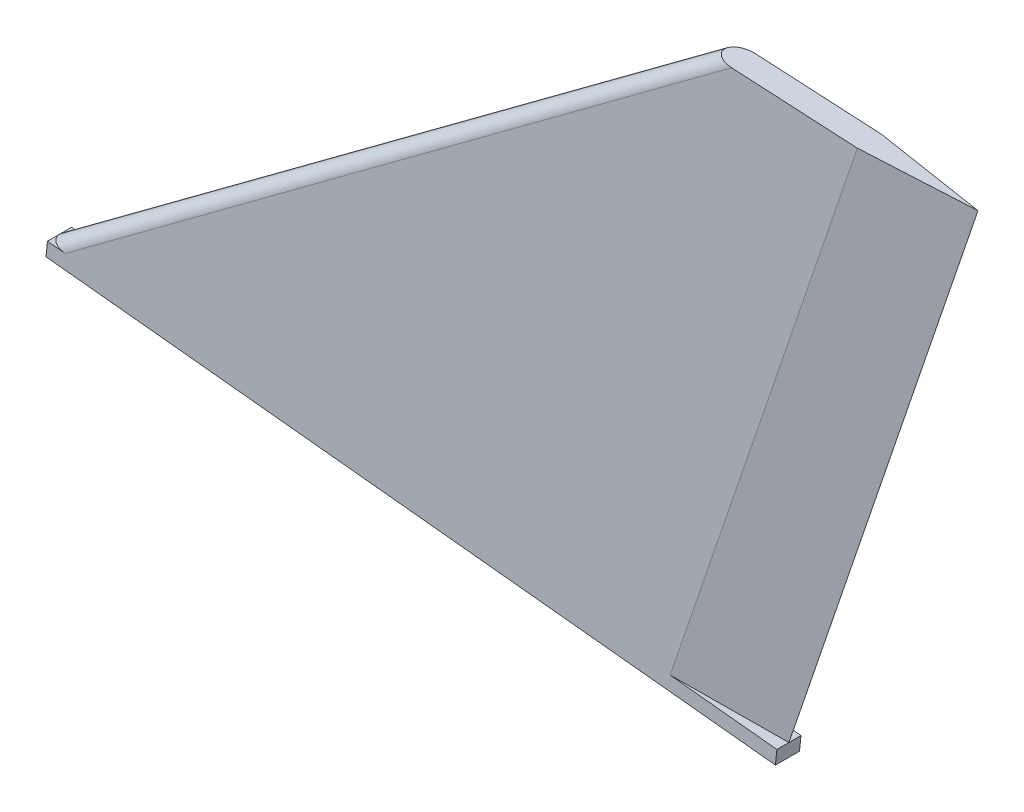
from build123d import *

# Parameters (mm, degrees)
BOSS_EXTRUDE1_DEPTH = 8.4
CUT_EXTRUDE2_DEPTH  = 362.634640928
CUT_EXTRUDE4_DEPTH  = 362.634640928
FILLET1_R           = 4.2
SKETCH14_W          = 255.7
SKETCH14_H          = 8.4
BOSS_EXTRUDE2_DEPTH = 5


with BuildPart() as part:
    # Sketch1 → Boss-Extrude1 (new body)
    with BuildSketch(Plane.XY):
        Polygon((320.267992754, 167.253247716), (254.340919031, -26.328442922), (0, 0), (231.995455688, 171.998687612), align=None)
    extrude(amount=BOSS_EXTRUDE1_DEPTH)

    # Sketch4 → Cut-Extrude2 (cut, through all)
    with BuildSketch(Plane(origin=(84.32608447, 247.606712606, 0), x_dir=(0, 0, -1), z_dir=(-0.32238177860112127, -0.9466097341703061, 0))):
        Polygon((0, 212.749400009), (-4.2, 249.249400009), (0, 249.249400009), align=None)
    extrude(amount=CUT_EXTRUDE2_DEPTH, mode=Mode.SUBTRACT)

    # Sketch10 → Cut-Extrude4 (cut, through all)
    with BuildSketch(Plane(origin=(84.32608447, 247.606712606, 0), x_dir=(0, 0, -1), z_dir=(-0.32238177860112127, -0.9466097341703061, 0))):
        Polygon((-4.2, 249.249400009), (-8.4, 212.749400009), (-8.4, 249.249400009), align=None)
    extrude(amount=CUT_EXTRUDE4_DEPTH, mode=Mode.SUBTRACT)

    # Fillet1
    fillet1_edges = [part.edges().sort_by_distance(p)[0] for p in [
        (115.997727844, 85.999343806, 0),
        (115.997727844, 85.999343806, 8.4),
    ]]
    fillet(fillet1_edges, radius=FILLET1_R - 0.0001)  # a hair under: the kernel refuses the full size

    # Sketch14 → Boss-Extrude2 (add)
    with BuildSketch(Plane(origin=(0, 0, 0), x_dir=(0.9946848612849409, -0.10296614361312137, 0), z_dir=(-0.10296614361312136, -0.9946848612849408, 0))):
        with Locations((127.85, 4.2)):
            Rectangle(SKETCH14_W, SKETCH14_H)
    extrude(amount=BOSS_EXTRUDE2_DEPTH)


solid = part.part
